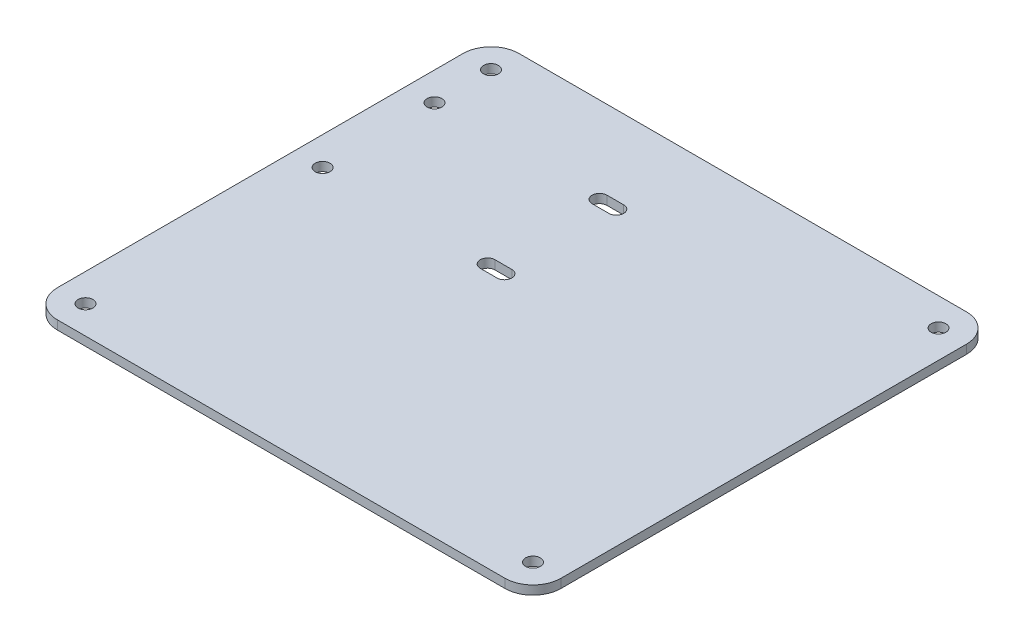
from build123d import *

# Parameters (mm, degrees)
SKETCH1_W          = 180
SKETCH1_H          = 165
BASE_FLANGE1_DEPTH = 3.175
FILLET1_R          = 10
SKETCH2_R          = 2.65
CUT_EXTRUDE1_DEPTH = 123.132430685
SKETCH3_R          = 2.65
CUT_EXTRUDE2_DEPTH = 123.132430685


# Sheet-metal steps are written as plain solids
with BuildPart() as part:
    # Sketch1 → Base-Flange1 (new body)
    with BuildSketch(Plane(origin=(0, 0, 0), x_dir=(1, 0, 0), z_dir=(0, 1, 0))):
        Rectangle(SKETCH1_W, SKETCH1_H)
    extrude(amount=-BASE_FLANGE1_DEPTH)

    # Fillet1
    fillet1_edges = [part.edges().sort_by_distance(p)[0] for p in [
        (90, -1.5875, 82.5),
        (-90, -1.5875, 82.5),
        (-90, -1.5875, -82.5),
        (90, -1.5875, -82.5),
    ]]
    fillet(fillet1_edges, radius=FILLET1_R)

    # Sketch2 → Cut-Extrude1 (cut, through all)
    with BuildSketch(Plane(origin=(0, 0, 0), x_dir=(1, 0, 0), z_dir=(0, 1, 0))):
        with Locations(Location((-80, 72.5, 0), (0, 0, 270))):
            Circle(SKETCH2_R)
        with Locations(Location((80, 72.5, 0), (0, 0, 270))):
            Circle(SKETCH2_R)
        with Locations(Location((-80, -72.5, 0), (0, 0, 270))):
            Circle(SKETCH2_R)
        with Locations(Location((80, -72.5, 0), (0, 0, 270))):
            Circle(SKETCH2_R)
    extrude(amount=-CUT_EXTRUDE1_DEPTH, mode=Mode.SUBTRACT)

    # Sketch3 → Cut-Extrude2 (cut, through all)
    with BuildSketch(Plane(origin=(0, 0, 0), x_dir=(1, 0, 0), z_dir=(0, 1, 0))):
        with Locations(Location((-79.8175, 52.1, 0), (0, 0, 270))):
            Circle(SKETCH3_R)
        with Locations(Location((-79.8175, 12.1, 0), (0, 0, 270))):
            Circle(SKETCH3_R)
        with BuildLine():
            Line((-20.41125, 54.35), (-14.41125, 54.35))
            ThreePointArc((-14.41125, 54.35), (-11.76125, 51.7), (-14.41125, 49.05))
            Line((-14.41125, 49.05), (-20.41125, 49.05))
            ThreePointArc((-20.41125, 49.05), (-23.06125, 51.7), (-20.41125, 54.35))
        make_face()
        with BuildLine():
            Line((-20.41125, 14.35), (-14.41125, 14.35))
            ThreePointArc((-14.41125, 14.35), (-11.76125, 11.7), (-14.41125, 9.05))
            Line((-14.41125, 9.05), (-20.41125, 9.05))
            ThreePointArc((-20.41125, 9.05), (-23.06125, 11.7), (-20.41125, 14.35))
        make_face()
    extrude(amount=-CUT_EXTRUDE2_DEPTH, mode=Mode.SUBTRACT)


solid = part.part
